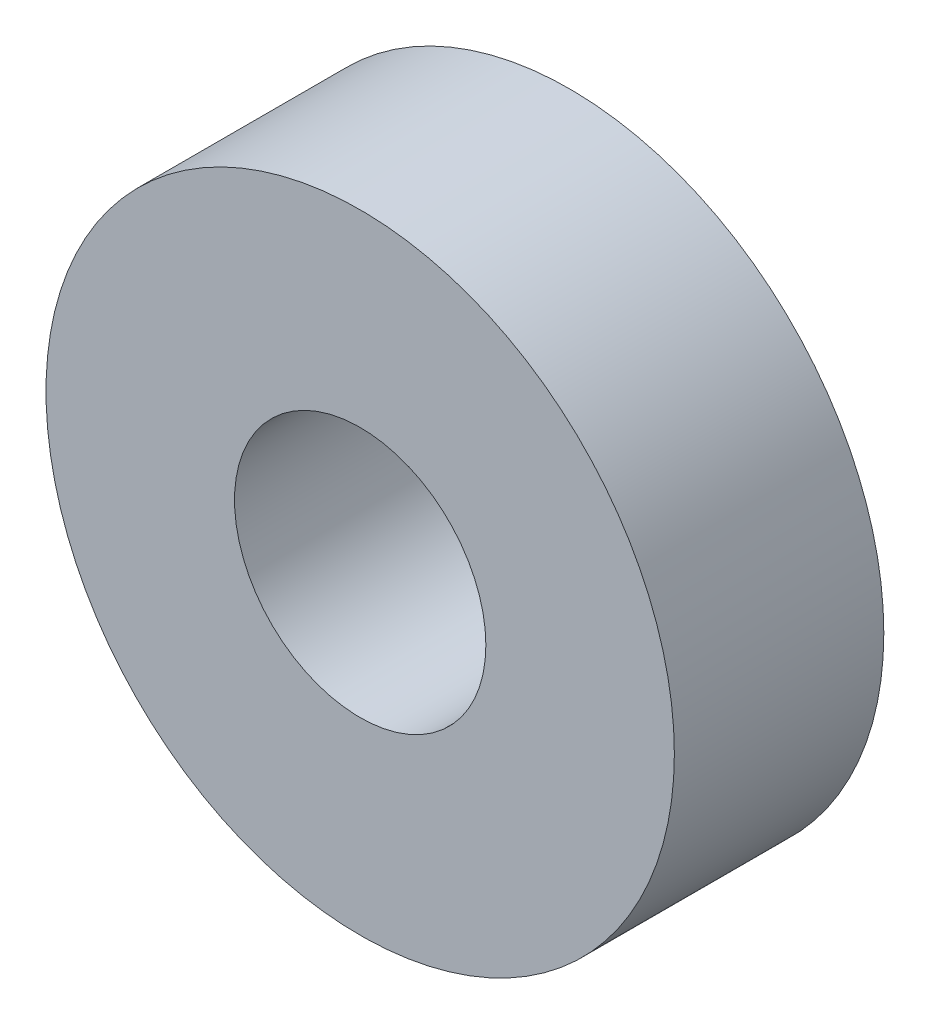
from build123d import *

# Parameters (mm, degrees)
SKETCH_1_R      = 7.5
SKETCH_1_R_2    = 3
EXTRUDE_1_DEPTH = 5


with BuildPart() as part:
    # Эскиз1 → Бобышка-Вытянуть1 (new body)
    with BuildSketch(Plane.XY):
        Circle(SKETCH_1_R)
        Circle(SKETCH_1_R_2, mode=Mode.SUBTRACT)
    extrude(amount=EXTRUDE_1_DEPTH)


solid = part.part
